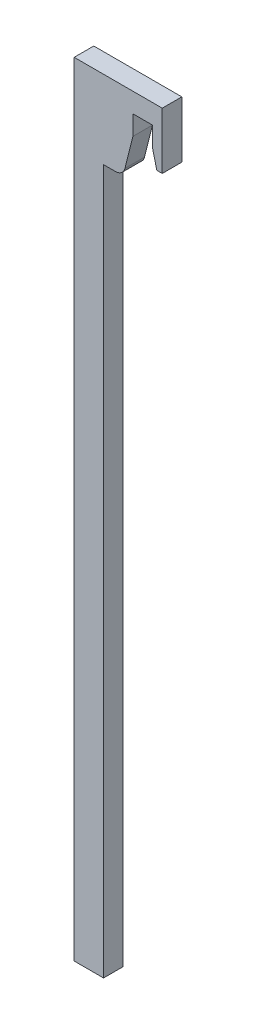
from build123d import *

# Parameters (mm, degrees)
BOSS_EXTRUDE2_DEPTH = 5
FILLET2_R           = 5
CUT_EXTRUDE2_DEPTH  = 10


with BuildPart() as part:
    # Sketch1 → Boss-Extrude2 (new, symmetric)
    with BuildSketch(Plane.XY):
        Polygon((-5, 0), (-5, 10), (5, 10), (5, 0), (10, -20), (10, 20), (-35, 20), (-35, -380), (-20, -380), (-20, -20), (-10, -20), align=None)
    extrude(amount=BOSS_EXTRUDE2_DEPTH, both=True)

    # Fillet2
    fillet2_edges = [part.edges().sort_by_distance(p)[0] for p in [
        (-10, -20, 0),
    ]]
    fillet(fillet2_edges, radius=FILLET2_R)

    # Sketch2 → Cut-Extrude2 (cut)
    with BuildSketch(Plane(origin=(0, 0, -5), x_dir=(-1, 0, 0), z_dir=(0, 0, -1))):
        Polygon((-10, -8.925486625), (-7.231371656, -8.925486625), (-10, -20), align=None)
    extrude(amount=-CUT_EXTRUDE2_DEPTH, mode=Mode.SUBTRACT)


solid = part.part
